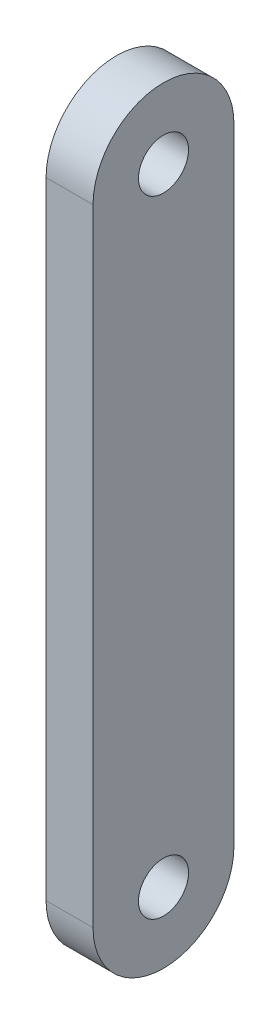
from build123d import *

# Parameters (mm, degrees)
SKETCH1_R           = 1.6
BOSS_EXTRUDE1_DEPTH = 3


with BuildPart() as part:
    # Sketch1 → Boss-Extrude1 (new body)
    with BuildSketch(Plane(origin=(0, 0, 0), x_dir=(0, 0, -1), z_dir=(1, 0, 0))):
        with BuildLine():
            Line((-4.5, 0), (-4.5, 40))
            ThreePointArc((-4.5, 40), (0, 44.5), (4.5, 40))
            Line((4.5, 40), (4.5, 0))
            ThreePointArc((4.5, 0), (0, -4.5), (-4.5, 0))
        make_face()
        with Locations((0, 40)):
            Circle(SKETCH1_R, mode=Mode.SUBTRACT)
        Circle(SKETCH1_R, mode=Mode.SUBTRACT)
    extrude(amount=BOSS_EXTRUDE1_DEPTH)


solid = part.part
